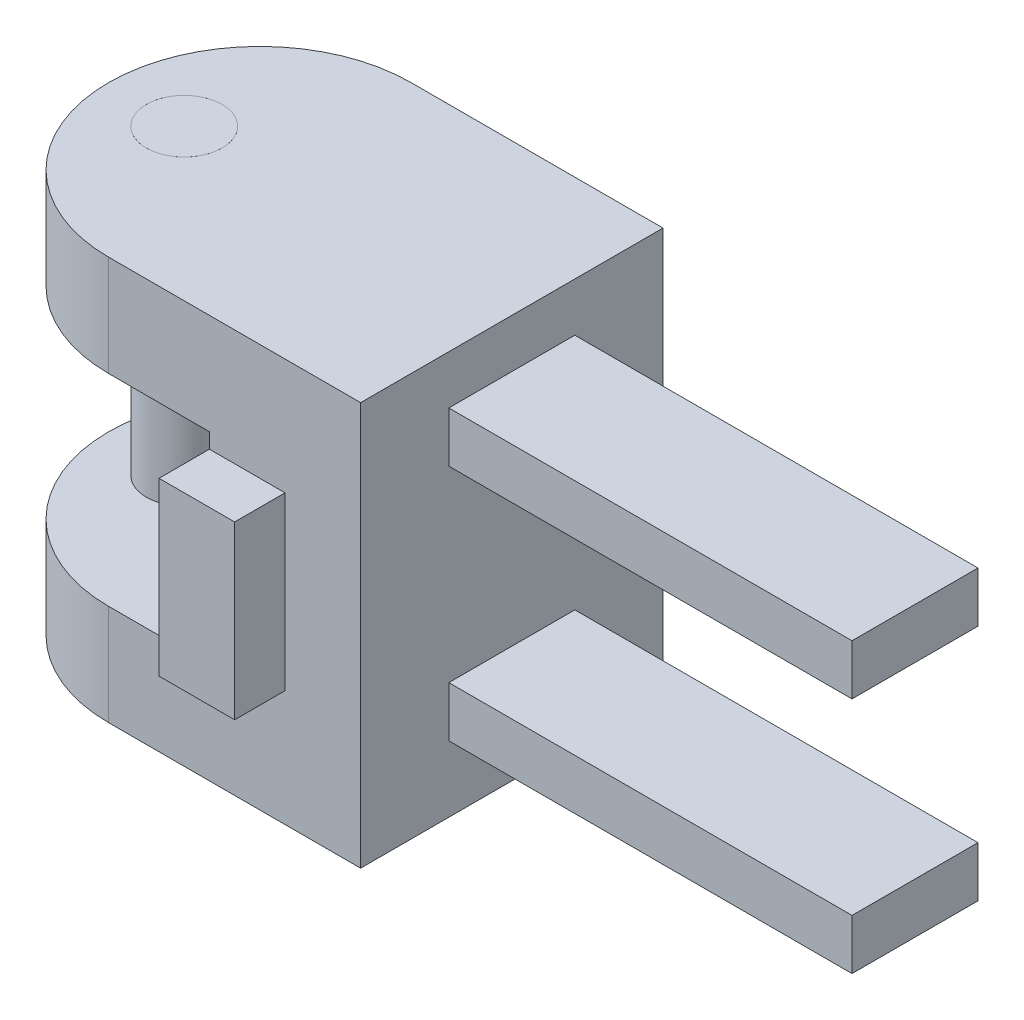
from build123d import *

# Parameters (mm, degrees)
BOSS_EXTRUDE1_DEPTH      = 30
SKETCH3_R                = 7.5
CUT_EXTRUDE1_DEPTH       = 30
FILLET1_R                = 30
FILLET2_R                = 30
MIRROR3_START            = 60
MIRROR3_OUTLINE_R        = 7.5
MIRROR3_DEPTH            = 20
MIRROR3_START_2          = 40
MIRROR3_2_OUTLINE_W      = 30
MIRROR3_2_OUTLINE_H      = 60
MIRROR3_2_DEPTH          = 20
SKETCH5_W                = 25
SKETCH5_H                = 10
BOSS_EXTRUDE3_DEPTH      = 80
SKETCH6_W                = 15
SKETCH6_H                = 34
BOSS_EXTRUDE4_DEPTH      = 10
SKETCH8_W                = 15
SKETCH8_H                = 34
BOSS_EXTRUDE5_DEPTH      = 10
BOSS_EXTRUDE6_DEPTH      = 60
BOSS_EXTRUDE6_DEPTH_BACK = 20
SKETCH9_R                = 7.5


# Read off the part's stored shape, not the designer's step: Mirror3
with BuildPart() as part:
    # Sketch1 → Boss-Extrude1 (new, symmetric)
    with BuildSketch(Plane.XY):
        Polygon((-80, 0), (-80, 20), (-30, 20), (-30, 40), (0, 40), (0, 0), align=None)
    extrude(amount=BOSS_EXTRUDE1_DEPTH, both=True)

    # Sketch3 → Cut-Extrude1 (cut)
    with BuildSketch(Plane(origin=(0, 20, 0), x_dir=(1, 0, 0), z_dir=(0, 1, 0))):
        with Locations(Location((-65, 0, 0), (0, 0, 270))):
            Circle(SKETCH3_R)
    extrude(amount=-CUT_EXTRUDE1_DEPTH, mode=Mode.SUBTRACT)

    # Fillet1
    fillet1_edges = [part.edges().sort_by_distance(p)[0] for p in [
        (-80, 10, 30),
    ]]
    fillet(fillet1_edges, radius=FILLET1_R)

    # Fillet2
    fillet2_edges = [part.edges().sort_by_distance(p)[0] for p in [
        (-80, 10, -30),
    ]]
    fillet(fillet2_edges, radius=FILLET2_R - 0.0001)  # a hair under: the kernel refuses the full size



with BuildPart() as body_2:
    # Mirror3 outline → Mirror3 (new body)
    with BuildSketch(Plane(origin=(0, 0, 0), x_dir=(1, 0, 0), z_dir=(0, 1, 0)).offset(MIRROR3_START)):
        with BuildLine():
            Line((0, -30), (0, 30))
            Line((0, 30), (-50, 30))
            ThreePointArc((-50, 30), (-71.213203436, 21.213203436), (-80, 0))
            ThreePointArc((-80, 0), (-71.213203436, -21.213203436), (-50, -30))
            Line((-50, -30), (0, -30))
        make_face()
        with Locations((-65, 0)):
            Circle(MIRROR3_OUTLINE_R, mode=Mode.SUBTRACT)
    extrude(amount=MIRROR3_DEPTH)


with BuildPart() as part_1:
    add(part.part)

    add(body_2.part)  # Mirror3 2 merges body 2
    # Mirror3 2 outline → Mirror3 2 (add)
    with BuildSketch(Plane(origin=(0, 0, 0), x_dir=(1, 0, 0), z_dir=(0, 1, 0)).offset(MIRROR3_START_2)):
        with Locations((-15, 0)):
            Rectangle(MIRROR3_2_OUTLINE_W, MIRROR3_2_OUTLINE_H)
    extrude(amount=MIRROR3_2_DEPTH)

    # Sketch5 → Boss-Extrude3 (add)
    with BuildSketch(Plane(origin=(0, 0, 0), x_dir=(0, 0, -1), z_dir=(1, 0, 0))):
        with Locations((0, 65.336865941)):
            Rectangle(SKETCH5_W, SKETCH5_H)
        with Locations((0, 18.138949218)):
            Rectangle(SKETCH5_W, SKETCH5_H)
    extrude(amount=BOSS_EXTRUDE3_DEPTH)

    # Sketch6 → Boss-Extrude4 (add)
    with BuildSketch(Plane.XY.offset(30)):
        with Locations((-22.5, 40)):
            Rectangle(SKETCH6_W, SKETCH6_H)
    extrude(amount=BOSS_EXTRUDE4_DEPTH)

    # Sketch8 → Boss-Extrude5 (add)
    with BuildSketch(Plane(origin=(0, 0, -30), x_dir=(-1, 0, 0), z_dir=(0, 0, -1))):
        with Locations((22.5, 40)):
            Rectangle(SKETCH8_W, SKETCH8_H)
    extrude(amount=BOSS_EXTRUDE5_DEPTH)


with BuildPart() as body_2_2:
    # Sketch9 → Boss-Extrude6 (new, two sides: drawn at the far end of the back side and taken through both)
    with BuildSketch(Plane(origin=(0, 20, 0), x_dir=(1, 0, 0), z_dir=(0, 1, 0)).offset(-BOSS_EXTRUDE6_DEPTH_BACK)):
        with Locations(Location((-65, 0, 0), (0, 0, 270))):
            Circle(SKETCH9_R)
    extrude(amount=BOSS_EXTRUDE6_DEPTH + BOSS_EXTRUDE6_DEPTH_BACK)


solid = Compound([part_1.part, body_2_2.part])
